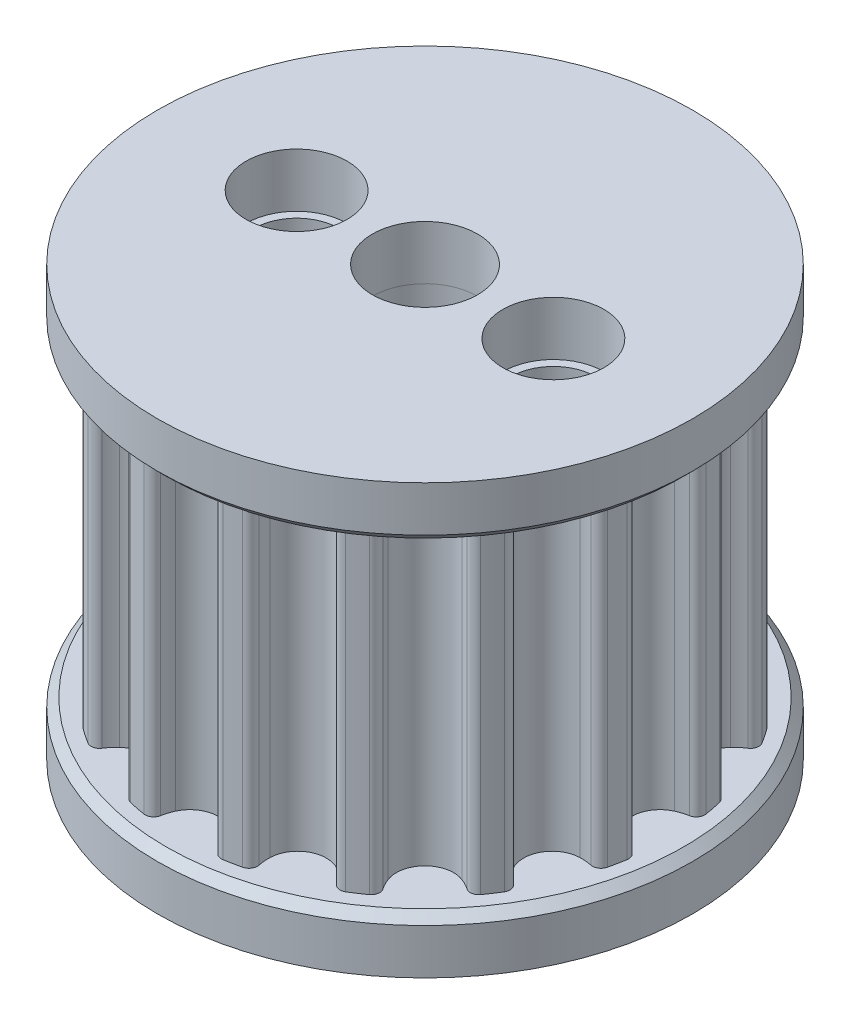
from build123d import *

# Parameters (mm, degrees)
SKETCH1_R           = 1.5625
BOSS_EXTRUDE1_DEPTH = 4.7625
SKETCH2_R           = 7.9375
SKETCH2_R_2         = 1.5625
BOSS_EXTRUDE2_DEPTH = 1.6002
SKETCH3_R           = 1.5
CUT_EXTRUDE1_DEPTH  = 16.804362927
SKETCH4_R           = 1.25
CUT_EXTRUDE2_DEPTH  = 15.721869362
CHAMFER1_SIZE       = 0.254


with BuildPart() as part:
    # Sketch1 → Boss-Extrude1 (new, symmetric)
    with BuildSketch(Plane(origin=(0, 0, 0), x_dir=(1, 0, 0), z_dir=(0, 1, 0))):
        with BuildLine():
            ThreePointArc((-1.850768, -6.777037356), (-1.816941892, -6.962421006), (-1.663291889, -7.071521784))
            ThreePointArc((-1.663291889, -7.071521784), (-1.417233644, -7.124914669), (-1.169472895, -7.169748489))
            ThreePointArc((-1.169472895, -7.169748489), (-0.985767742, -7.127751824), (-0.883573242, -6.969424355))
            ThreePointArc((-0.883573242, -6.969424355), (-0.839120956, -6.792881518), (-0.773880597, -6.622919538))
            ThreePointArc((-0.773880597, -6.622919538), (0, -6.1245), (0.773880597, -6.622919538))
            ThreePointArc((0.773880597, -6.622919538), (0.839120956, -6.792881518), (0.883573242, -6.969424355))
            ThreePointArc((0.883573242, -6.969424355), (0.985767742, -7.127751824), (1.169472895, -7.169748489))
            ThreePointArc((1.169472895, -7.169748489), (1.417233644, -7.124914669), (1.663291889, -7.071521784))
            ThreePointArc((1.663291889, -7.071521784), (1.816941892, -6.962421006), (1.850768, -6.777037356))
            ThreePointArc((1.850768, -6.777037356), (1.824276538, -6.596921889), (1.819509137, -6.414931089))
            ThreePointArc((1.819509137, -6.414931089), (2.343744682, -5.658300197), (3.249454025, -5.822628523))
            ThreePointArc((3.249454025, -5.822628523), (3.374769892, -5.954686513), (3.483398468, -6.100779674))
            ThreePointArc((3.483398468, -6.100779674), (3.638403174, -6.20794704), (3.824196033, -6.176445981))
            ThreePointArc((3.824196033, -6.176445981), (4.035939958, -6.040210999), (4.242835561, -5.896719991))
            ThreePointArc((4.242835561, -5.896719991), (4.343038594, -5.737124705), (4.303346591, -5.552907854))
            ThreePointArc((4.303346591, -5.552907854), (4.209944466, -5.396640704), (4.135895098, -5.230327534))
            ThreePointArc((4.135895098, -5.230327534), (4.330675481, -4.330675481), (5.230327534, -4.135895098))
            ThreePointArc((5.230327534, -4.135895098), (5.396640704, -4.209944466), (5.552907854, -4.303346591))
            ThreePointArc((5.552907854, -4.303346591), (5.737124705, -4.343038594), (5.896719991, -4.242835561))
            ThreePointArc((5.896719991, -4.242835561), (6.040210999, -4.035939958), (6.176445981, -3.824196033))
            ThreePointArc((6.176445981, -3.824196033), (6.20794704, -3.638403174), (6.100779674, -3.483398468))
            ThreePointArc((6.100779674, -3.483398468), (5.954686513, -3.374769892), (5.822628523, -3.249454025))
            ThreePointArc((5.822628523, -3.249454025), (5.658300197, -2.343744682), (6.414931089, -1.819509137))
            ThreePointArc((6.414931089, -1.819509137), (6.596921889, -1.824276538), (6.777037356, -1.850768))
            ThreePointArc((6.777037356, -1.850768), (6.962421006, -1.816941892), (7.071521784, -1.663291889))
            ThreePointArc((7.071521784, -1.663291889), (7.124914669, -1.417233644), (7.169748489, -1.169472895))
            ThreePointArc((7.169748489, -1.169472895), (7.127751824, -0.985767742), (6.969424355, -0.883573242))
            ThreePointArc((6.969424355, -0.883573242), (6.792881518, -0.839120956), (6.622919538, -0.773880597))
            ThreePointArc((6.622919538, -0.773880597), (6.1245, 0), (6.622919538, 0.773880597))
            ThreePointArc((6.622919538, 0.773880597), (6.792881518, 0.839120956), (6.969424355, 0.883573242))
            ThreePointArc((6.969424355, 0.883573242), (7.127751824, 0.985767742), (7.169748489, 1.169472895))
            ThreePointArc((7.169748489, 1.169472895), (7.124914669, 1.417233644), (7.071521784, 1.663291889))
            ThreePointArc((7.071521784, 1.663291889), (6.962421006, 1.816941892), (6.777037356, 1.850768))
            ThreePointArc((6.777037356, 1.850768), (6.596921889, 1.824276538), (6.414931089, 1.819509137))
            ThreePointArc((6.414931089, 1.819509137), (5.658300197, 2.343744682), (5.822628523, 3.249454025))
            ThreePointArc((5.822628523, 3.249454025), (5.954686513, 3.374769892), (6.100779674, 3.483398468))
            ThreePointArc((6.100779674, 3.483398468), (6.20794704, 3.638403174), (6.176445981, 3.824196033))
            ThreePointArc((6.176445981, 3.824196033), (6.040210999, 4.035939958), (5.896719991, 4.242835561))
            ThreePointArc((5.896719991, 4.242835561), (5.737124705, 4.343038594), (5.552907854, 4.303346591))
            ThreePointArc((5.552907854, 4.303346591), (5.396640704, 4.209944466), (5.230327534, 4.135895098))
            ThreePointArc((5.230327534, 4.135895098), (4.330675481, 4.330675481), (4.135895098, 5.230327534))
            ThreePointArc((4.135895098, 5.230327534), (4.209944466, 5.396640704), (4.303346591, 5.552907854))
            ThreePointArc((4.303346591, 5.552907854), (4.343038594, 5.737124705), (4.242835561, 5.896719991))
            ThreePointArc((4.242835561, 5.896719991), (4.035939958, 6.040210999), (3.824196033, 6.176445981))
            ThreePointArc((3.824196033, 6.176445981), (3.638403174, 6.20794704), (3.483398468, 6.100779674))
            ThreePointArc((3.483398468, 6.100779674), (3.374769892, 5.954686513), (3.249454025, 5.822628523))
            ThreePointArc((3.249454025, 5.822628523), (2.343744682, 5.658300197), (1.819509137, 6.414931089))
            ThreePointArc((1.819509137, 6.414931089), (1.824276538, 6.596921889), (1.850768, 6.777037356))
            ThreePointArc((1.850768, 6.777037356), (1.816941892, 6.962421006), (1.663291889, 7.071521784))
            ThreePointArc((1.663291889, 7.071521784), (1.417233644, 7.124914669), (1.169472895, 7.169748489))
            ThreePointArc((1.169472895, 7.169748489), (0.985767742, 7.127751824), (0.883573242, 6.969424355))
            ThreePointArc((0.883573242, 6.969424355), (0.839120956, 6.792881518), (0.773880597, 6.622919538))
            ThreePointArc((0.773880597, 6.622919538), (0, 6.1245), (-0.773880597, 6.622919538))
            ThreePointArc((-0.773880597, 6.622919538), (-0.839120956, 6.792881518), (-0.883573242, 6.969424355))
            ThreePointArc((-0.883573242, 6.969424355), (-0.985767742, 7.127751824), (-1.169472895, 7.169748489))
            ThreePointArc((-1.169472895, 7.169748489), (-1.417233644, 7.124914669), (-1.663291889, 7.071521784))
            ThreePointArc((-1.663291889, 7.071521784), (-1.816941892, 6.962421006), (-1.850768, 6.777037356))
            ThreePointArc((-1.850768, 6.777037356), (-1.824276538, 6.596921889), (-1.819509137, 6.414931089))
            ThreePointArc((-1.819509137, 6.414931089), (-2.343744682, 5.658300197), (-3.249454025, 5.822628523))
            ThreePointArc((-3.249454025, 5.822628523), (-3.374769892, 5.954686513), (-3.483398468, 6.100779674))
            ThreePointArc((-3.483398468, 6.100779674), (-3.638403174, 6.20794704), (-3.824196033, 6.176445981))
            ThreePointArc((-3.824196033, 6.176445981), (-4.035939958, 6.040210999), (-4.242835561, 5.896719991))
            ThreePointArc((-4.242835561, 5.896719991), (-4.343038594, 5.737124705), (-4.303346591, 5.552907854))
            ThreePointArc((-4.303346591, 5.552907854), (-4.209944466, 5.396640704), (-4.135895098, 5.230327534))
            ThreePointArc((-4.135895098, 5.230327534), (-4.330675481, 4.330675481), (-5.230327534, 4.135895098))
            ThreePointArc((-5.230327534, 4.135895098), (-5.396640704, 4.209944466), (-5.552907854, 4.303346591))
            ThreePointArc((-5.552907854, 4.303346591), (-5.737124705, 4.343038594), (-5.896719991, 4.242835561))
            ThreePointArc((-5.896719991, 4.242835561), (-6.040210999, 4.035939958), (-6.176445981, 3.824196033))
            ThreePointArc((-6.176445981, 3.824196033), (-6.20794704, 3.638403174), (-6.100779674, 3.483398468))
            ThreePointArc((-6.100779674, 3.483398468), (-5.954686513, 3.374769892), (-5.822628523, 3.249454025))
            ThreePointArc((-5.822628523, 3.249454025), (-5.658300197, 2.343744682), (-6.414931089, 1.819509137))
            ThreePointArc((-6.414931089, 1.819509137), (-6.596921889, 1.824276538), (-6.777037356, 1.850768))
            ThreePointArc((-6.777037356, 1.850768), (-6.962421006, 1.816941892), (-7.071521784, 1.663291889))
            ThreePointArc((-7.071521784, 1.663291889), (-7.124914669, 1.417233644), (-7.169748489, 1.169472895))
            ThreePointArc((-7.169748489, 1.169472895), (-7.127751824, 0.985767742), (-6.969424355, 0.883573242))
            ThreePointArc((-6.969424355, 0.883573242), (-6.792881518, 0.839120956), (-6.622919538, 0.773880597))
            ThreePointArc((-6.622919538, 0.773880597), (-6.1245, 0), (-6.622919538, -0.773880597))
            ThreePointArc((-6.622919538, -0.773880597), (-6.792881518, -0.839120956), (-6.969424355, -0.883573242))
            ThreePointArc((-6.969424355, -0.883573242), (-7.127751824, -0.985767742), (-7.169748489, -1.169472895))
            ThreePointArc((-7.169748489, -1.169472895), (-7.124914669, -1.417233644), (-7.071521784, -1.663291889))
            ThreePointArc((-7.071521784, -1.663291889), (-6.962421006, -1.816941892), (-6.777037356, -1.850768))
            ThreePointArc((-6.777037356, -1.850768), (-6.596921889, -1.824276538), (-6.414931089, -1.819509137))
            ThreePointArc((-6.414931089, -1.819509137), (-5.658300197, -2.343744682), (-5.822628523, -3.249454025))
            ThreePointArc((-5.822628523, -3.249454025), (-5.954686513, -3.374769892), (-6.100779674, -3.483398468))
            ThreePointArc((-6.100779674, -3.483398468), (-6.20794704, -3.638403174), (-6.176445981, -3.824196033))
            ThreePointArc((-6.176445981, -3.824196033), (-6.040210999, -4.035939958), (-5.896719991, -4.242835561))
            ThreePointArc((-5.896719991, -4.242835561), (-5.737124705, -4.343038594), (-5.552907854, -4.303346591))
            ThreePointArc((-5.552907854, -4.303346591), (-5.396640704, -4.209944466), (-5.230327534, -4.135895098))
            ThreePointArc((-5.230327534, -4.135895098), (-4.330675481, -4.330675481), (-4.135895098, -5.230327534))
            ThreePointArc((-4.135895098, -5.230327534), (-4.209944466, -5.396640704), (-4.303346591, -5.552907854))
            ThreePointArc((-4.303346591, -5.552907854), (-4.343038594, -5.737124705), (-4.242835561, -5.896719991))
            ThreePointArc((-4.242835561, -5.896719991), (-4.035939958, -6.040210999), (-3.824196033, -6.176445981))
            ThreePointArc((-3.824196033, -6.176445981), (-3.638403174, -6.20794704), (-3.483398468, -6.100779674))
            ThreePointArc((-3.483398468, -6.100779674), (-3.374769892, -5.954686513), (-3.249454025, -5.822628523))
            ThreePointArc((-3.249454025, -5.822628523), (-2.343744682, -5.658300197), (-1.819509137, -6.414931089))
            ThreePointArc((-1.819509137, -6.414931089), (-1.824276538, -6.596921889), (-1.850768, -6.777037356))
        make_face()
        Circle(SKETCH1_R, mode=Mode.SUBTRACT)
    extrude(amount=BOSS_EXTRUDE1_DEPTH, both=True)

    # Sketch4 → Cut-Extrude2 (cut, through all)
    with BuildSketch(Plane.XZ.offset(4.7625)):
        with Locations((-3.81, 0)):
            Circle(SKETCH4_R)
        with Locations((3.81, 0)):
            Circle(SKETCH4_R)
    extrude(amount=-CUT_EXTRUDE2_DEPTH, mode=Mode.SUBTRACT)


with BuildPart() as body_2:
    # Sketch2 → Boss-Extrude2 (new body)
    with BuildSketch(Plane.XZ.offset(4.7625)):
        Circle(SKETCH2_R)
        Circle(SKETCH2_R_2, mode=Mode.SUBTRACT)
    extrude(amount=BOSS_EXTRUDE2_DEPTH)

    # Sketch3 → Cut-Extrude1 (cut, through all)
    with BuildSketch(Plane.XZ.offset(6.3627)):
        with Locations((-3.81, 0)):
            Circle(SKETCH3_R)
        with Locations((3.81, 0)):
            Circle(SKETCH3_R)
    extrude(amount=-CUT_EXTRUDE1_DEPTH, mode=Mode.SUBTRACT)

    # Chamfer1
    chamfer1_edges = [body_2.edges().sort_by_distance(p)[0] for p in [
        (-7.9375, -4.7625, 0),
    ]]
    chamfer(chamfer1_edges, length=CHAMFER1_SIZE)


with BuildPart() as body_3:
    # Mirror2: mirrored copy
    add(body_2.part.mirror(Plane.ZX))


solid = Compound([part.part, body_2.part, body_3.part])
